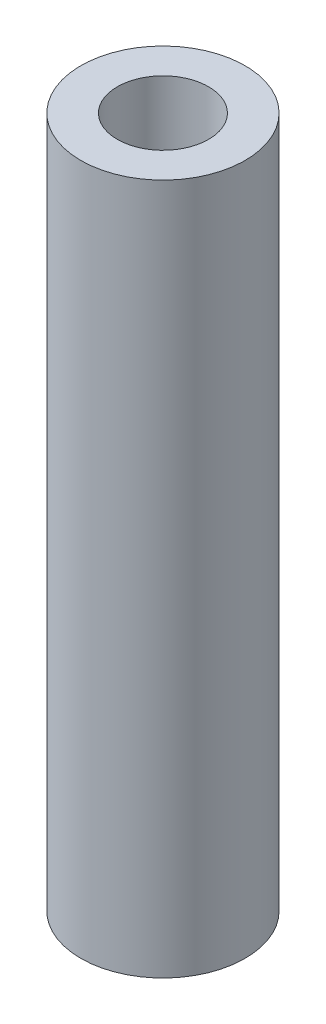
from build123d import *

# Parameters (mm, degrees)
SZKIC1_W = 28
SZKIC1_H = 530


with BuildPart() as part:
    # Szkic1 → Obrót1 (revolve)
    with BuildSketch(Plane.XY):
        with Locations((49, 0)):
            Rectangle(SZKIC1_W, SZKIC1_H)
    revolve(axis=Axis((0, 344.744344029, 0), (0, -1, 0)))


solid = part.part
